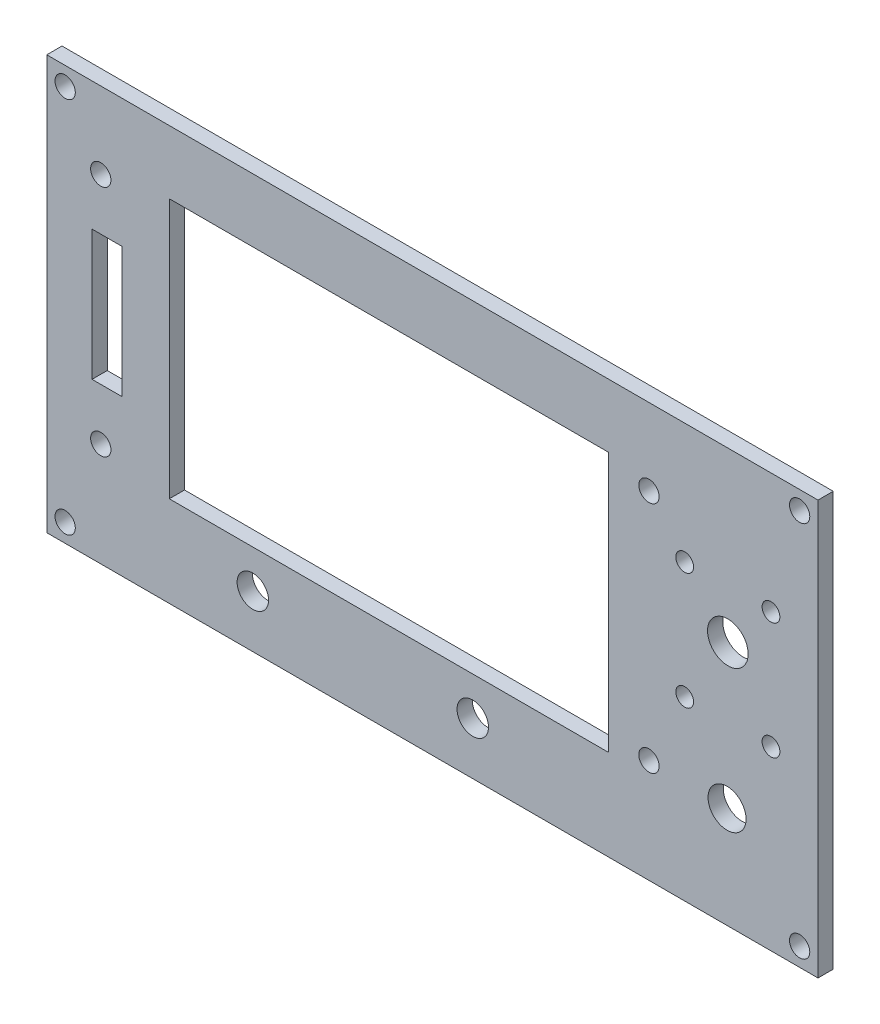
from build123d import *

# Parameters (mm, degrees)
ESQUISSE1_W        = 151.93976922
ESQUISSE1_H        = 81.544216856
ESQUISSE1_R        = 2
ESQUISSE1_R_2      = 4
ESQUISSE1_R_3      = 1.75
ESQUISSE1_R_4      = 3.75
ESQUISSE1_R_5      = 3.1
ESQUISSE1_W_2      = 86.5
ESQUISSE1_H_2      = 51.2
ESQUISSE1_W_3      = 5.937566171
ESQUISSE1_H_3      = 25.632907614
BOSS_EXTRU_1_DEPTH = 3


with BuildPart() as part:
    # Esquisse1 → Boss.-Extru.1 (new body)
    with BuildSketch(Plane.XY.offset(-2.2)):
        with Locations((-43.862390942, -0.866617279)):
            Rectangle(ESQUISSE1_W, ESQUISSE1_H)
        with Locations((-109.194417438, 24.821428571)):
            Circle(ESQUISSE1_R, mode=Mode.SUBTRACT)
        with Locations((-109.194417438, -21.178571429)):
            Circle(ESQUISSE1_R, mode=Mode.SUBTRACT)
        with Locations((-1.194417438, -21.178571429)):
            Circle(ESQUISSE1_R, mode=Mode.SUBTRACT)
        with Locations((-1.194417438, 24.821428571)):
            Circle(ESQUISSE1_R, mode=Mode.SUBTRACT)
        with Locations((-116.210955208, 36.284170806)):
            Circle(ESQUISSE1_R, mode=Mode.SUBTRACT)
        with Locations((-116.210955208, -38.017405363)):
            Circle(ESQUISSE1_R, mode=Mode.SUBTRACT)
        with Locations((28.486173324, 36.284170806)):
            Circle(ESQUISSE1_R, mode=Mode.SUBTRACT)
        with Locations((28.486173324, -38.017405363)):
            Circle(ESQUISSE1_R, mode=Mode.SUBTRACT)
        with Locations((14.345224597, 6.749852674)):
            Circle(ESQUISSE1_R_2, mode=Mode.SUBTRACT)
        with Locations((5.845224597, 16.204342535)):
            Circle(ESQUISSE1_R_3, mode=Mode.SUBTRACT)
        with Locations((22.845224597, 16.204342535)):
            Circle(ESQUISSE1_R_3, mode=Mode.SUBTRACT)
        with Locations((22.845224597, -6.795657465)):
            Circle(ESQUISSE1_R_3, mode=Mode.SUBTRACT)
        with Locations((5.845224597, -6.795657465)):
            Circle(ESQUISSE1_R_3, mode=Mode.SUBTRACT)
        with Locations((14.194599357, -21.638725707)):
            Circle(ESQUISSE1_R_4, mode=Mode.SUBTRACT)
        with Locations((-79.237508709, -31.316718293)):
            Circle(ESQUISSE1_R_5, mode=Mode.SUBTRACT)
        with Locations((-35.905557573, -31.316718293)):
            Circle(ESQUISSE1_R_5, mode=Mode.SUBTRACT)
        with Locations((-52.444417438, 1.821428571)):
            Rectangle(ESQUISSE1_W_2, ESQUISSE1_H_2, mode=Mode.SUBTRACT)
        with Locations((-107.94493025, 1.811094224)):
            Rectangle(ESQUISSE1_W_3, ESQUISSE1_H_3, mode=Mode.SUBTRACT)
    extrude(amount=BOSS_EXTRU_1_DEPTH)


solid = part.part
